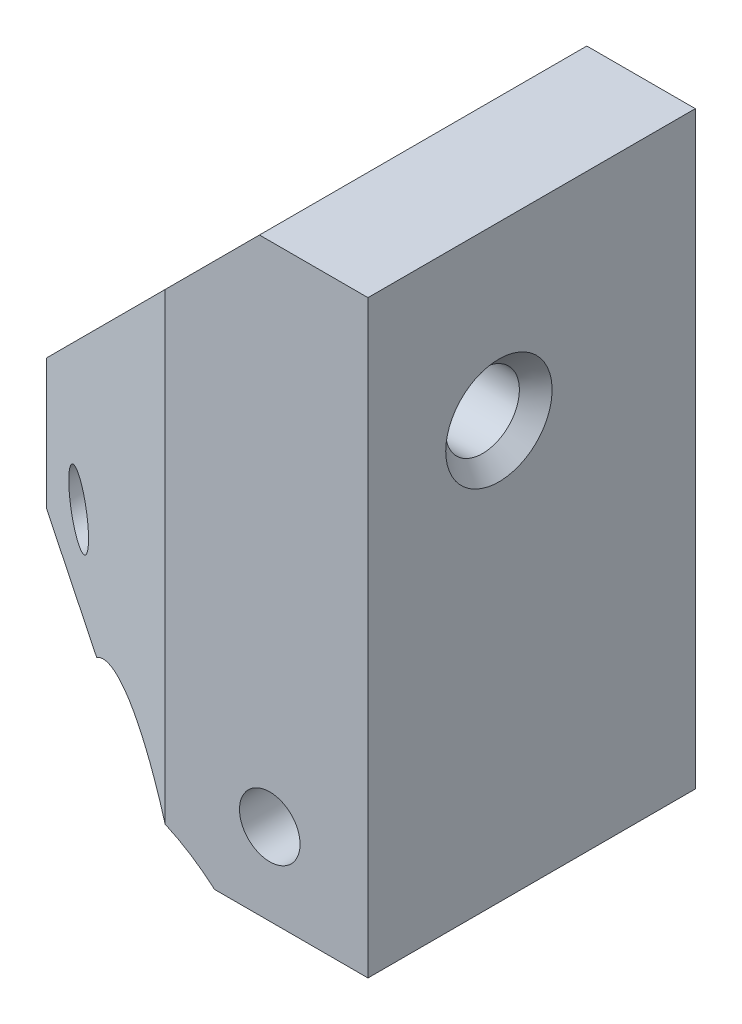
from build123d import *

# Parameters (mm, degrees)
SKETCH1_W           = 34.63
SKETCH1_H           = 10
SKETCH1_R           = 1.85
BOSS_EXTRUDE1_DEPTH = 20
CHAMFER1_SIZE       = 1
SKETCH2_R           = 12
CUT_EXTRUDE1_DEPTH  = 27.9222812
BOSS_EXTRUDE2_DEPTH = 26
SKETCH5_R           = 2.25
CUT_EXTRUDE3_DEPTH  = 51.598783582
CHAMFER2_SIZE       = 1
CHAMFER3_SIZE       = 28
CHAMFER4_SIZE       = 22.238414528
CHAMFER4_SIZE_2     = 15


with BuildPart() as part:
    # Sketch1 → Boss-Extrude1 (new body)
    with BuildSketch(Plane.XY):
        Rectangle(SKETCH1_W, SKETCH1_H)
        with Locations((-11.315, 0)):
            Circle(SKETCH1_R, mode=Mode.SUBTRACT)
        with Locations((11.315, 0)):
            Circle(SKETCH1_R, mode=Mode.SUBTRACT)
    extrude(amount=BOSS_EXTRUDE1_DEPTH)

    # Chamfer1
    chamfer1_edges = [part.edges().sort_by_distance(p)[0] for p in [
        (-13.165, 0, 0),
        (9.465, 0, 0),
    ]]
    chamfer(chamfer1_edges, length=CHAMFER1_SIZE)

    # Sketch2 → Cut-Extrude1 (cut, through all)
    with BuildSketch(Plane.XY.offset(20)):
        with Locations((0, -14)):
            Circle(SKETCH2_R)
    extrude(amount=-CUT_EXTRUDE1_DEPTH, mode=Mode.SUBTRACT)

    # Sketch3 → Boss-Extrude2 (add)
    with BuildSketch(Plane(origin=(0, 5, 0), x_dir=(1, 0, 0), z_dir=(0, 1, 0))):
        Polygon((-17.315, 0), (-17.315, -20), (11.315, -20), (17.315, -20), (17.315, 0), align=None)
    extrude(amount=BOSS_EXTRUDE2_DEPTH)

    # Sketch5 → Cut-Extrude3 (cut, through all)
    with BuildSketch(Plane(origin=(17.315, 0, 0), x_dir=(0, 0, -1), z_dir=(1, 0, 0))):
        with Locations((-12, 20.5)):
            Circle(SKETCH5_R)
    extrude(amount=-CUT_EXTRUDE3_DEPTH, mode=Mode.SUBTRACT)

    # Chamfer2
    chamfer2_edges = [part.edges().sort_by_distance(p)[0] for p in [
        (17.315, 20.5, 14.25),
    ]]
    chamfer(chamfer2_edges, length=CHAMFER2_SIZE)

    # Chamfer3
    # the kernel refuses this chamfer: 28 mm, written as the material it takes off along each edge
    with BuildSketch(Plane(origin=(-17.315, 31, -72.007123663), x_dir=(0.9996219169112968, 0.027495876610586365, 0), z_dir=(0, 0, 1))) as chamfer3_piece_1:
        Polygon((CHAMFER3_SIZE * 0.999621916911, -CHAMFER3_SIZE * 0.0274958766106), (-CHAMFER3_SIZE * 0.0274958766106, -CHAMFER3_SIZE * 0.999621916911), (0, 0), align=None)
    extrude(amount=164.014247326, mode=Mode.SUBTRACT)

    # Chamfer4
    # the kernel refuses this chamfer: 22.238414528, 15 mm, written as the material it takes off along each edge
    with BuildSketch(Plane(origin=(-17.315, 60.453144221, 20), x_dir=(0.9997657259302418, 0, 0.021644705014774085), z_dir=(0, -1, 0))) as chamfer4_piece_1:
        Polygon((CHAMFER4_SIZE * 0.999765725916, -CHAMFER4_SIZE * 0.0216447050145), (-CHAMFER4_SIZE_2 * 0.0216447050148, -CHAMFER4_SIZE_2 * 0.99976572593), (0, 0), align=None)
    extrude(amount=122.906288442, mode=Mode.SUBTRACT)


solid = part.part
